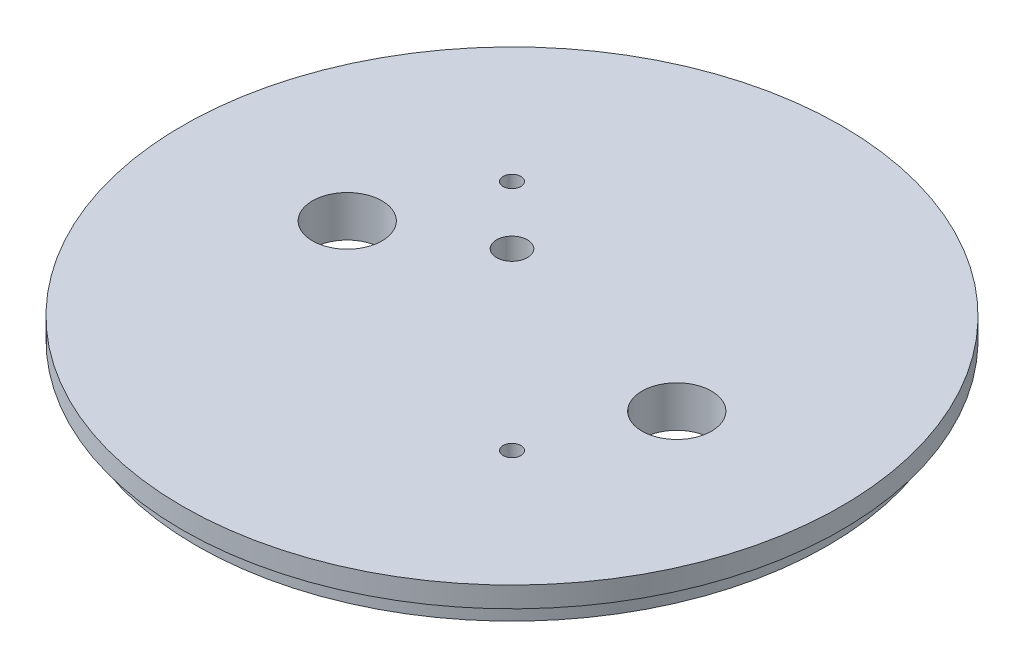
from build123d import *

# Parameters (mm, degrees)
SKETCH1_R           = 50.8
SKETCH1_R_2         = 5.3578125
SKETCH1_R_3         = 1.3589
SKETCH1_R_4         = 2.38125
BOSS_EXTRUDE1_DEPTH = 6.35
SKETCH2_R           = 50.8
SKETCH2_R_2         = 48.641
CUT_EXTRUDE1_DEPTH  = 3.175
CUT_EXTRUDE2_START  = -2.794
CUT_EXTRUDE2_DEPTH  = 3.81


with BuildPart() as part:
    # Sketch1 → Boss-Extrude1 (new body)
    with BuildSketch(Plane(origin=(0, 0, 0), x_dir=(1, 0, 0), z_dir=(0, 1, 0))):
        Circle(SKETCH1_R)
        with Locations((25.4, 0)):
            Circle(SKETCH1_R_2, mode=Mode.SUBTRACT)
        with Locations((-25.4, 0)):
            Circle(SKETCH1_R_2, mode=Mode.SUBTRACT)
        with Locations((-17.960512242, 17.960512242)):
            Circle(SKETCH1_R_3, mode=Mode.SUBTRACT)
        with Locations((17.960512242, -17.960512242)):
            Circle(SKETCH1_R_3, mode=Mode.SUBTRACT)
        with Locations((-8.980256121, 8.980256121)):
            Circle(SKETCH1_R_4, mode=Mode.SUBTRACT)
    extrude(amount=BOSS_EXTRUDE1_DEPTH)

    # Sketch2 → Cut-Extrude1 (cut)
    with BuildSketch(Plane.XZ):
        Circle(SKETCH2_R)
        Circle(SKETCH2_R_2, mode=Mode.SUBTRACT)
    extrude(amount=-CUT_EXTRUDE1_DEPTH, mode=Mode.SUBTRACT)

    # Sketch3 → Cut-Extrude2 (cut)
    with BuildSketch(Plane(origin=(0, 6.35, 0), x_dir=(1, 0, 0), z_dir=(0, 1, 0)).offset(CUT_EXTRUDE2_START)):
        with BuildLine():
            Line((3.2385, 34.798), (3.2385, 13.97))
            ThreePointArc((3.2385, 13.97), (0, 10.7315), (-3.2385, 13.97))
            Line((-3.2385, 13.97), (-3.2385, 34.798))
            ThreePointArc((-3.2385, 34.798), (0, 38.0365), (3.2385, 34.798))
        make_face()
        with BuildLine():
            Line((3.2385, -34.798), (3.2385, -13.97))
            ThreePointArc((3.2385, -13.97), (0, -10.7315), (-3.2385, -13.97))
            Line((-3.2385, -13.97), (-3.2385, -34.798))
            ThreePointArc((-3.2385, -34.798), (0, -38.0365), (3.2385, -34.798))
        make_face()
    extrude(amount=-CUT_EXTRUDE2_DEPTH, mode=Mode.SUBTRACT)


solid = part.part
